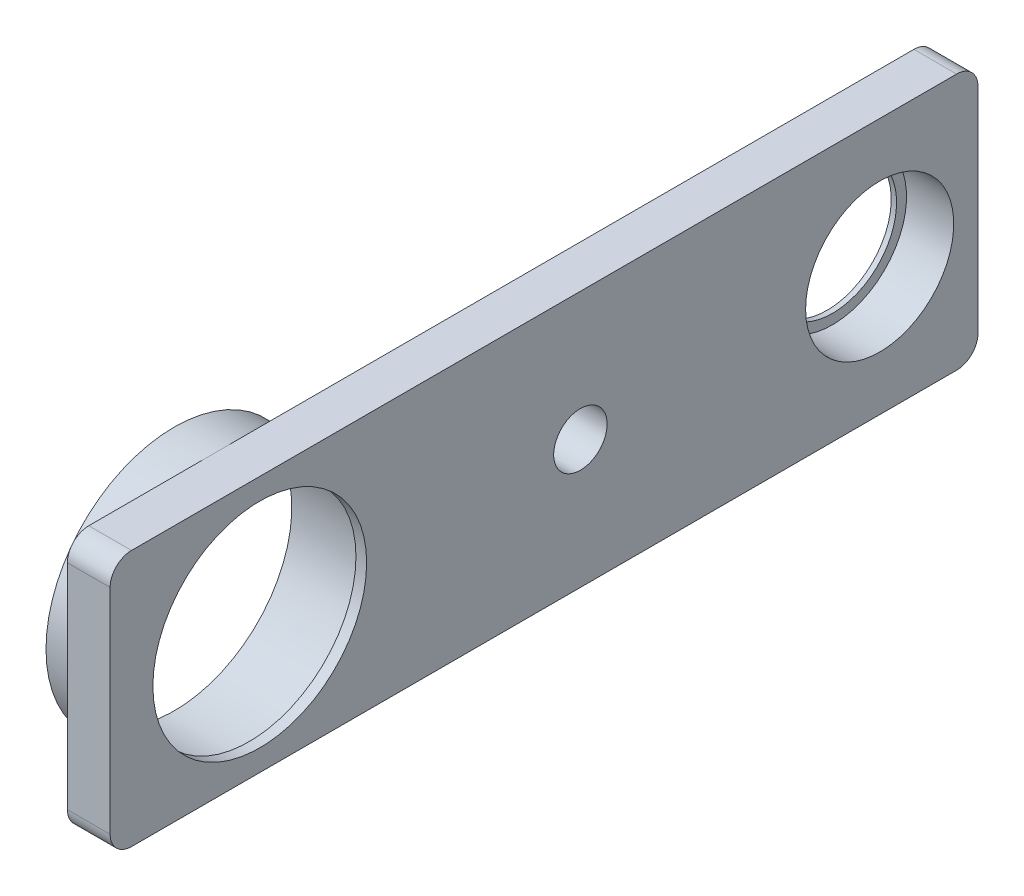
from build123d import *

# Parameters (mm, degrees)
SKETCH1_W            = 123.825
SKETCH1_H            = 38.1
SKETCH1_R            = 17.4625
SKETCH1_R_2          = 3.96875
SKETCH1_R_3          = 4.7625
BOSS_EXTRUDE1_DEPTH  = 6.35
BOSS_EXTRUDE3_START  = -1.5875
SKETCH3_R            = 17.4625
SKETCH3_R_2          = 15.875
BOSS_EXTRUDE3_DEPTH  = 1.5875
BOSS_EXTRUDE5_START  = 6.35
SKETCH5_R            = 19.05
SKETCH5_R_2          = 17.4625
BOSS_EXTRUDE5_DEPTH  = 6.35
SKETCH17_W           = 6.35
SKETCH17_H           = 38.1
BOSS_EXTRUDE8_DEPTH  = 5.08
CUT_EXTRUDE3_REACH   = 136.568
SKETCH16_R           = 11
BOSS_EXTRUDE9_START  = 0.6604
SKETCH18_R           = 12.7
SKETCH18_R_2         = 11
BOSS_EXTRUDE9_DEPTH  = 0.6604
FILLET2_R            = 3.175
BOSS_EXTRUDE10_START = 0.79375
SKETCH19_R           = 12.7
SKETCH19_R_2         = 9.525
BOSS_EXTRUDE10_DEPTH = 0.79375


with BuildPart() as part:
    # Sketch1 → Boss-Extrude1 (new body)
    with BuildSketch(Plane(origin=(0, 0, 0), x_dir=(0, 0, -1), z_dir=(1, 0, 0))):
        with Locations((61.9125, 19.05)):
            Rectangle(SKETCH1_W, SKETCH1_H)
        with Locations((22.225, 19.05)):
            Circle(SKETCH1_R, mode=Mode.SUBTRACT)
        with Locations((69.85, 19.05)):
            Circle(SKETCH1_R_2, mode=Mode.SUBTRACT)
        with Locations((114.3, 19.05)):
            Circle(SKETCH1_R_3, mode=Mode.SUBTRACT)
    extrude(amount=BOSS_EXTRUDE1_DEPTH)

    # Sketch3 → Boss-Extrude3 (add)
    with BuildSketch(Plane(origin=(6.35, 0, 0), x_dir=(0, 0, -1), z_dir=(1, 0, 0)).offset(BOSS_EXTRUDE3_START)):
        with Locations((22.225, 19.05)):
            Circle(SKETCH3_R)
        with Locations((22.225, 19.05)):
            Circle(SKETCH3_R_2, mode=Mode.SUBTRACT)
    extrude(amount=BOSS_EXTRUDE3_DEPTH)

    # Sketch5 → Boss-Extrude5 (add)
    with BuildSketch(Plane.ZY.offset(BOSS_EXTRUDE5_START)):
        with Locations((-22.225, 19.05)):
            Circle(SKETCH5_R)
        with Locations((-22.225, 19.05)):
            Circle(SKETCH5_R_2, mode=Mode.SUBTRACT)
    extrude(amount=-BOSS_EXTRUDE5_DEPTH)

    # Sketch17 → Boss-Extrude8 (add)
    with BuildSketch(Plane(origin=(0, 0, -123.825), x_dir=(-1, 0, 0), z_dir=(0, 0, -1))):
        with Locations((-3.175, 19.05)):
            Rectangle(SKETCH17_W, SKETCH17_H)
    extrude(amount=BOSS_EXTRUDE8_DEPTH)

    # Sketch16 → Cut-Extrude3 (cut, up to next)
    with BuildSketch(Plane.ZY, mode=Mode.PRIVATE) as cut_extrude3_sk1:
        with Locations((-114.3, 19.05)):
            Circle(SKETCH16_R)
    cut_extrude3_tool1 = extrude(cut_extrude3_sk1.sketch, amount=-CUT_EXTRUDE3_REACH, mode=Mode.PRIVATE) & part.part
    add(cut_extrude3_tool1.solids().sort_by_distance((0, 19.05, -114.3))[0], mode=Mode.SUBTRACT)

    # Sketch18 → Boss-Extrude9 (add)
    with BuildSketch(Plane.ZY.offset(BOSS_EXTRUDE9_START)):
        with Locations((-114.3, 19.05)):
            Circle(SKETCH18_R)
        with Locations((-114.3, 19.05)):
            Circle(SKETCH18_R_2, mode=Mode.SUBTRACT)
    extrude(amount=-BOSS_EXTRUDE9_DEPTH)

    # Fillet2
    fillet2_edges = [part.edges().sort_by_distance(p)[0] for p in [
        (3.175, 0, -128.905),
        (3.175, 38.1, -128.905),
        (3.175, 0, 0),
        (3.175, 38.1, 0),
    ]]
    fillet(fillet2_edges, radius=FILLET2_R)

    # Sketch19 → Boss-Extrude10 (add)
    with BuildSketch(Plane.ZY.offset(0.6604).offset(BOSS_EXTRUDE10_START)):
        with Locations((-114.3, 19.05)):
            Circle(SKETCH19_R)
        with Locations((-114.3, 19.05)):
            Circle(SKETCH19_R_2, mode=Mode.SUBTRACT)
    extrude(amount=-BOSS_EXTRUDE10_DEPTH)


solid = part.part
